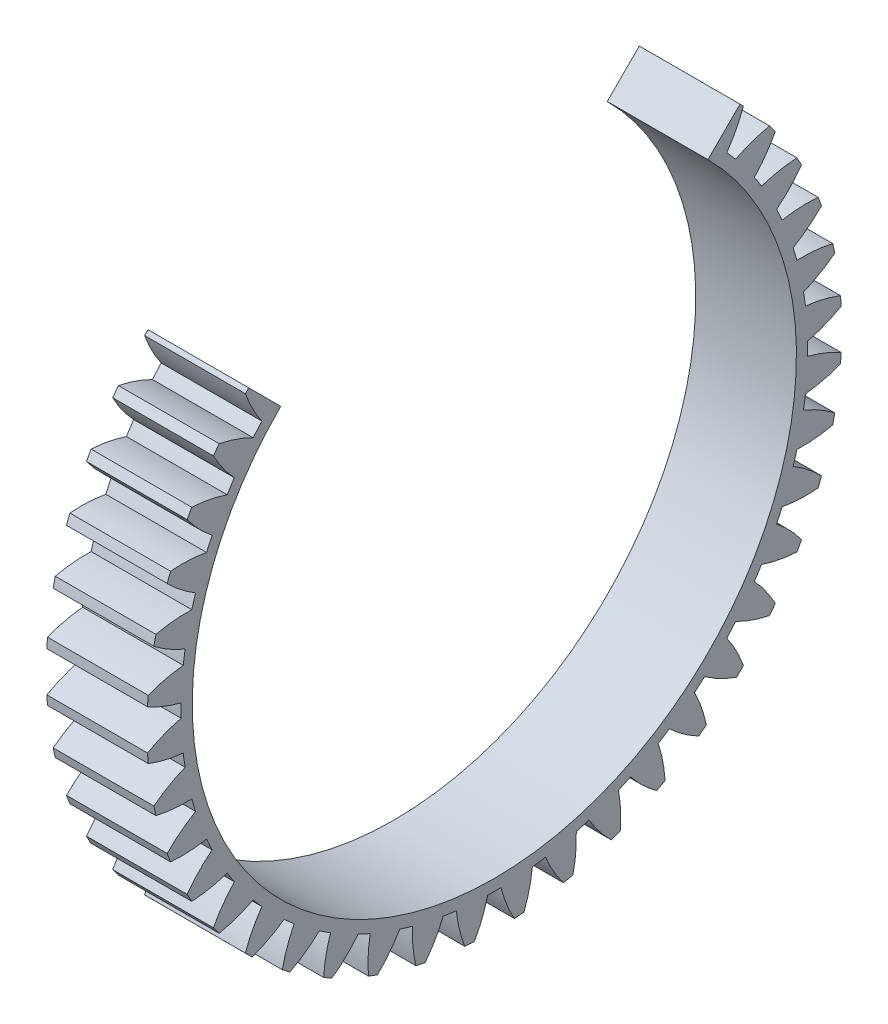
from build123d import *

# Parameters (mm, degrees)
BASPROSKE_W        = 10
BASPROSKE_H        = 34.5
TOOTHCUT_DEPTH     = 50.80461826
TEETHCUTS_COUNT    = 44
TEETHCUTS_ANGLE    = 351.818181818
BORSKE_R           = 30
BORE_DEPTH         = 50.0000508
CUT_EXTRUDE1_DEPTH = 50.725324144


with BuildPart() as part:
    # BasProSke → Base-Revolve (revolve)
    with BuildSketch(Plane(origin=(0, 0, 0), x_dir=(1, 0, 0), z_dir=(0, 1, 0))):
        with Locations((5, 17.25)):
            Rectangle(BASPROSKE_W, BASPROSKE_H)
    revolve(axis=Axis((-10, 0, 0), (1, 0, 0)))

    # TooCutSke → ToothCut (cut, through all)
    with BuildSketch(Plane(origin=(0, 0, 0), x_dir=(0, 0, -1), z_dir=(1, 0, 0))):
        with BuildLine():
            ThreePointArc((0.659078276, 31.117020934), (0, 31.124), (-0.659078276, 31.117020934))
            ThreePointArc((-0.659078276, 31.117020934), (-1.214735342, 32.838267173), (-2.000473431, 34.467395481))
            ThreePointArc((-2.000473431, 34.467395481), (0, 34.5254), (2.000473431, 34.467395481))
            ThreePointArc((2.000473431, 34.467395481), (1.214735342, 32.838267173), (0.659078276, 31.117020934))
        make_face()
    toothcut = extrude(amount=TOOTHCUT_DEPTH, mode=Mode.SUBTRACT)

    # TeethCuts: ToothCut ×44 about axis
    teethcuts_axis = Axis((-10, 0, 0), (1, 0, 0))
    for i in range(1, TEETHCUTS_COUNT):
        add(toothcut.rotate(teethcuts_axis, i * TEETHCUTS_ANGLE / (TEETHCUTS_COUNT - 1)), mode=Mode.SUBTRACT)

    # BorSke → Bore (cut, symmetric)
    with BuildSketch(Plane(origin=(0, 0, 0), x_dir=(0, 0, -1), z_dir=(1, 0, 0))):
        Circle(BORSKE_R)
    extrude(amount=BORE_DEPTH, both=True, mode=Mode.SUBTRACT)

    # Sketch1 → Cut-Extrude1 (cut, through all)
    with BuildSketch(Plane(origin=(10, 0, 0), x_dir=(0, 0, -1), z_dir=(1, 0, 0))):
        with BuildLine():
            Line((-24.395183951, 24.395183951), (-21.213203436, 21.213203436))
            ThreePointArc((-21.213203436, 21.213203436), (0, 30), (21.213203436, 21.213203436))
            Line((21.213203436, 21.213203436), (24.395183951, 24.395183951))
            ThreePointArc((24.395183951, 24.395183951), (0, 34.5), (-24.395183951, 24.395183951))
        make_face()
    extrude(amount=-CUT_EXTRUDE1_DEPTH, mode=Mode.SUBTRACT)


solid = part.part
